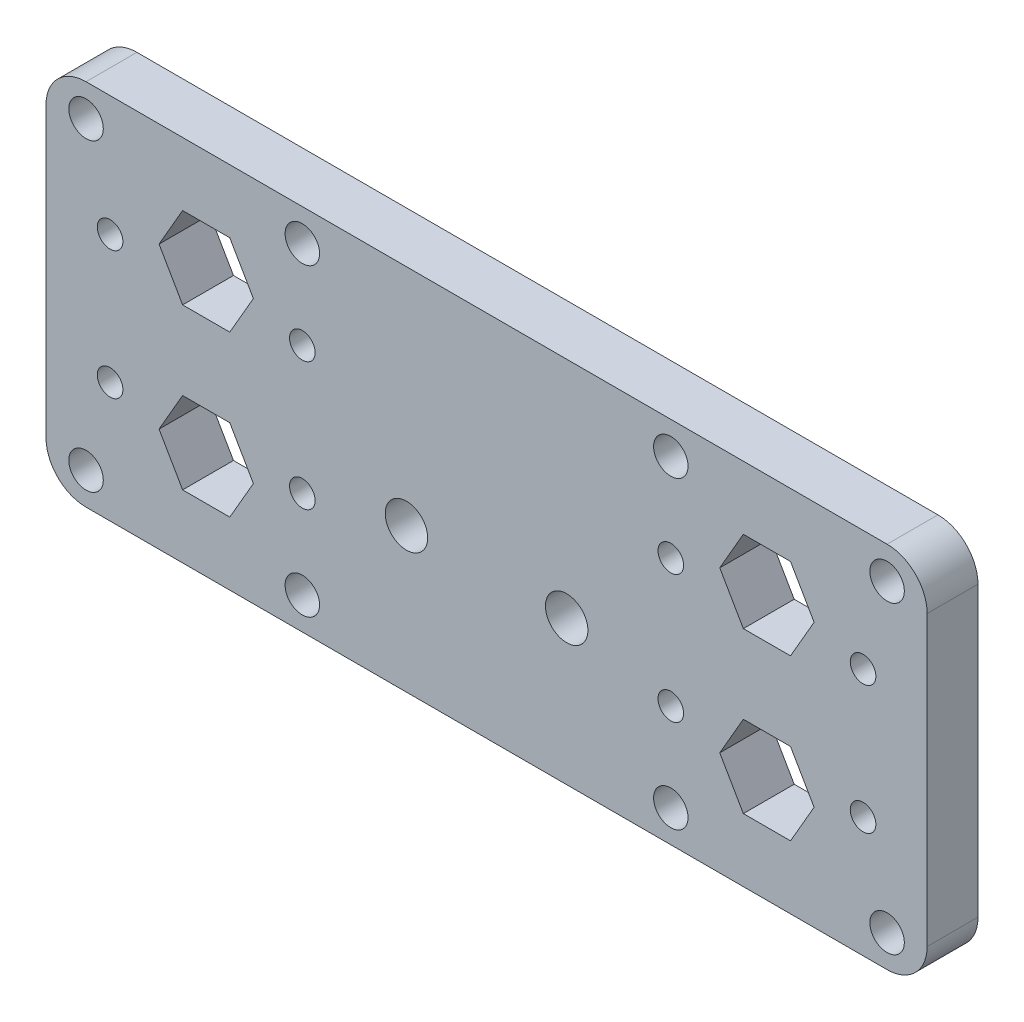
from build123d import *

# Parameters (mm, degrees)
SKETCH1_W             = 110
SKETCH1_H             = 46
BOSS_EXTRUDE1_DEPTH   = 6.35
CUT_EXTRUDE1_DEPTH    = 60.952668831
M3_CLEARANCE_HOLE1_D  = 3.2
FILLET1_R             = 5
M5_CLEARANCE_HOLE1_D  = 5.3
F_8_CLEARANCE_HOLE1_D = 4.3053


with BuildPart() as part:
    # Sketch1 → Boss-Extrude1 (new body)
    with BuildSketch(Plane.XY):
        Rectangle(SKETCH1_W, SKETCH1_H)
    extrude(amount=BOSS_EXTRUDE1_DEPTH)

    # Sketch2 → Cut-Extrude1 (cut, through all)
    with BuildSketch(Plane.XY.offset(6.35)):
        Polygon((-32.055513627, 15.1), (-37.944486373, 15.1), (-40.888972746, 10), (-37.944486373, 4.9), (-32.055513627, 4.9), (-29.111027254, 10), align=None)
        Polygon((37.944486373, 15.1), (32.055513627, 15.1), (29.111027254, 10), (32.055513627, 4.9), (37.944486373, 4.9), (40.888972746, 10), align=None)
        Polygon((37.944486373, -4.9), (32.055513627, -4.9), (29.111027254, -10), (32.055513627, -15.1), (37.944486373, -15.1), (40.888972746, -10), align=None)
        Polygon((-32.055513627, -4.9), (-37.944486373, -4.9), (-40.888972746, -10), (-37.944486373, -15.1), (-32.055513627, -15.1), (-29.111027254, -10), align=None)
    extrude(amount=-CUT_EXTRUDE1_DEPTH, mode=Mode.SUBTRACT)

    # M3 Clearance Hole1 (through all)
    with Locations(Plane(origin=(0, 0, 0), x_dir=(-1, 0, 0), z_dir=(0, 0, -1))):
        with Locations((-47, 8), (-23, 8), (-23, -8), (-47, -8), (23, -8), (23, 8), (47, 8), (47, -8)):
            Hole(M3_CLEARANCE_HOLE1_D / 2)

    # Fillet1
    fillet1_edges = [part.edges().sort_by_distance(p)[0] for p in [
        (-55, 23, 3.175),
        (-55, -23, 3.175),
        (55, -23, 3.175),
        (55, 23, 3.175),
    ]]
    fillet(fillet1_edges, radius=FILLET1_R)

    # M5 Clearance Hole1 (through all)
    with Locations(Plane.XY.offset(6.35)):
        with Locations((-10, -5), (10, -5)):
            Hole(M5_CLEARANCE_HOLE1_D / 2)

    # #8 Clearance Hole1 (through all)
    with Locations(Plane.XY.offset(6.35)):
        with Locations((-23, 19), (-23, -19), (23, -19), (23, 19), (-50, 19), (-50, -19), (50, -19), (50, 19)):
            Hole(F_8_CLEARANCE_HOLE1_D / 2)


solid = part.part
